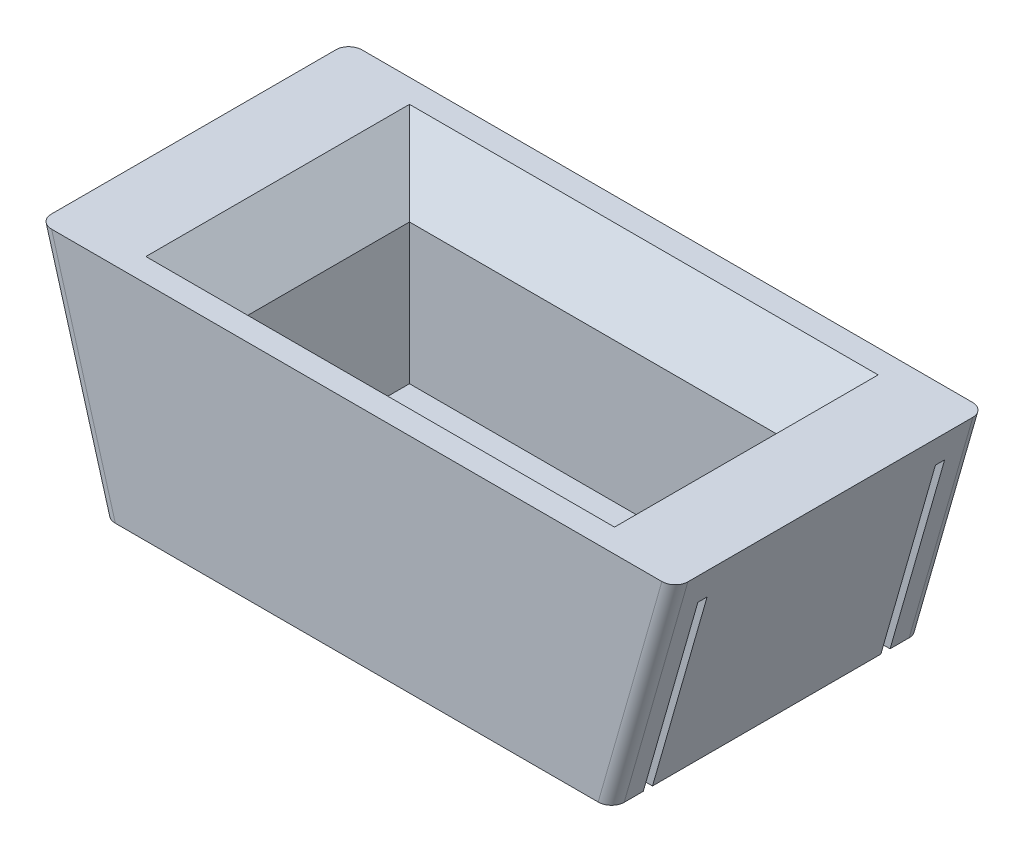
from build123d import *

# Parameters (mm, degrees)
SKETCH1_W           = 127
SKETCH1_H           = 61.9252
BOSS_EXTRUDE1_DEPTH = 44.45
SKETCH1_3_W         = 127
SKETCH1_3_H         = 1.8415
CUT_EXTRUDE2_DEPTH  = 38.1
SKETCH2_W           = 73.152
SKETCH2_H           = 32.258
SKETCH2_W_2         = 35.442647017
SKETCH2_H_2         = 23.182829488
CUT_EXTRUDE3_DEPTH  = 38.1
CHAMFER2_SIZE       = 10.16
CUT_EXTRUDE5_DEPTH  = 100.210800294
FILLET3_R           = 2.54
SKETCH2_3_W         = 35.442647017
SKETCH2_3_H         = 23.182829488
CUT_EXTRUDE6_DEPTH  = 84.466970107
CHAMFER3_SIZE       = 2.54


with BuildPart() as part:
    # Sketch1 → Boss-Extrude1 (new body)
    with BuildSketch(Plane(origin=(0, 0, 0), x_dir=(1, 0, 0), z_dir=(0, 1, 0))):
        Rectangle(SKETCH1_W, SKETCH1_H)
    extrude(amount=BOSS_EXTRUDE1_DEPTH)

    # Sketch1<3> → Cut-Extrude2 (cut)
    with BuildSketch(Plane(origin=(0, 0, 0), x_dir=(1, 0, 0), z_dir=(0, 1, 0))):
        with Locations((0, -23.69185)):
            Rectangle(SKETCH1_3_W, SKETCH1_3_H)
        with Locations((0, 23.69185)):
            Rectangle(SKETCH1_3_W, SKETCH1_3_H)
    extrude(amount=CUT_EXTRUDE2_DEPTH, mode=Mode.SUBTRACT)

    # Sketch2 → Cut-Extrude3 (cut)
    with BuildSketch(Plane(origin=(0, 44.45, 0), x_dir=(1, 0, 0), z_dir=(0, 1, 0))):
        Rectangle(SKETCH2_W, SKETCH2_H)
        with Locations((14.501754589, 0)):
            Rectangle(SKETCH2_W_2, SKETCH2_H_2, mode=Mode.SUBTRACT)
    extrude(amount=-CUT_EXTRUDE3_DEPTH, mode=Mode.SUBTRACT)

    # Chamfer2
    chamfer2_edges = [part.edges().sort_by_distance(p)[0] for p in [
        (0, 44.45, 16.129),
        (-36.576, 44.45, 0),
        (0, 44.45, -16.129),
        (36.576, 44.45, 0),
    ]]
    chamfer(chamfer2_edges, length=CHAMFER2_SIZE)

    # Sketch7 → Cut-Extrude5 (cut, through all)
    with BuildSketch(Plane.XY.offset(30.9626)):
        Polygon((-50.795476794, 0), (-63.5, 44.45), (-63.5, 0), align=None)
        Polygon((63.5, 44.45), (50.795476794, 0), (63.5, 0), align=None)
    extrude(amount=-CUT_EXTRUDE5_DEPTH, mode=Mode.SUBTRACT)

    # Fillet3
    fillet3_edges = [part.edges().sort_by_distance(p)[0] for p in [
        (-57.147738397, 22.225, 30.9626),
        (-57.147738397, 22.225, -30.9626),
        (57.147738397, 22.225, -30.9626),
        (57.147738397, 22.225, 30.9626),
    ]]
    fillet(fillet3_edges, radius=FILLET3_R)

    # Sketch2<3> → Cut-Extrude6 (cut, through all)
    with BuildSketch(Plane(origin=(0, 44.45, 0), x_dir=(1, 0, 0), z_dir=(0, 1, 0))):
        with Locations((14.501754589, 0)):
            Rectangle(SKETCH2_3_W, SKETCH2_3_H)
    extrude(amount=-CUT_EXTRUDE6_DEPTH, mode=Mode.SUBTRACT)

    # Chamfer3
    chamfer3_edges = [part.edges().sort_by_distance(p)[0] for p in [
        (14.501754589, 0, 11.591414744),
        (-3.21956892, 0, 0),
        (32.223078097, 0, 0),
        (14.501754589, 0, -11.591414744),
    ]]
    chamfer(chamfer3_edges, length=CHAMFER3_SIZE)


solid = part.part
